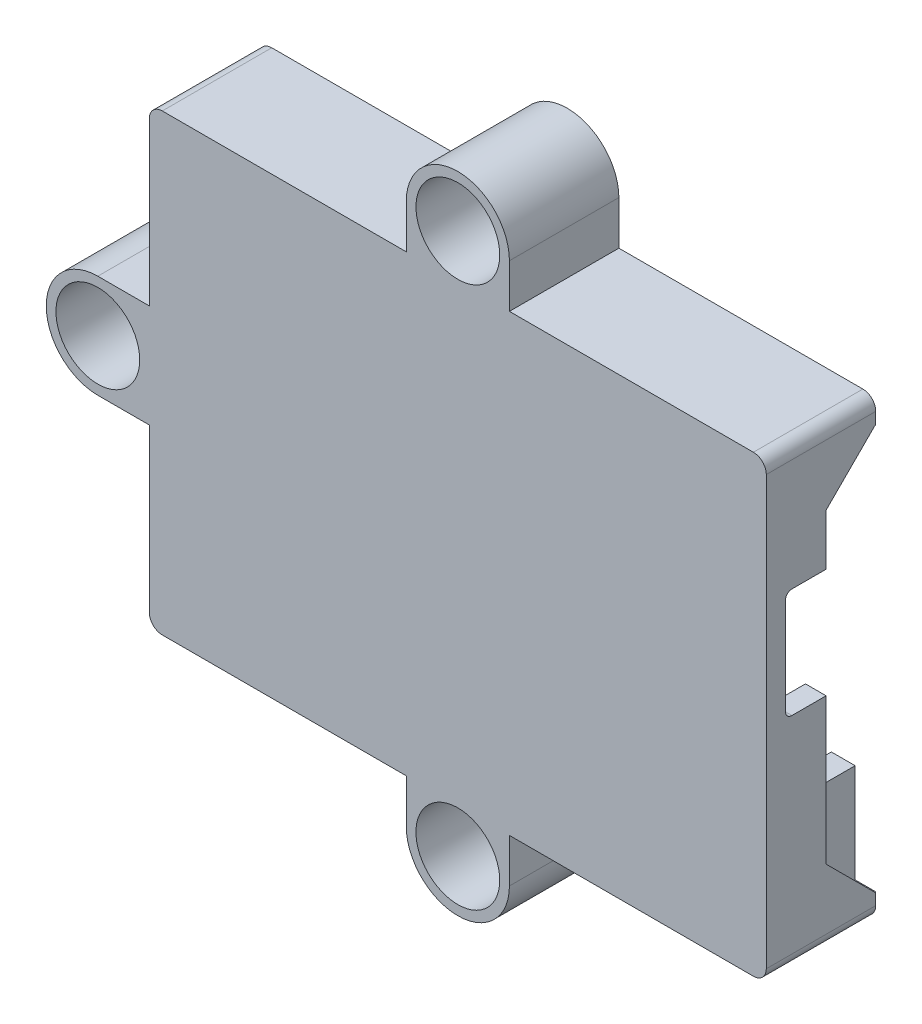
from build123d import *

# Parameters (mm, degrees)
SKETCH1_W           = 47.85
SKETCH1_H           = 35.2
SKETCH1_W_2         = 44.65
SKETCH1_H_2         = 32
BOSS_EXTRUDE1_DEPTH = 6.99
SKETCH2_W           = 47.85
SKETCH2_H           = 35.2
BOSS_EXTRUDE2_DEPTH = 1.5
CUT_EXTRUDE1_REACH  = 53.686
SKETCH4_W           = 3.5
SKETCH4_H           = 8.5
CUT_EXTRUDE2_DEPTH  = 1.6
CUT_EXTRUDE3_REACH  = 45.4
SKETCH6_W           = 10.4
SKETCH6_H           = 6.6
FILLET1_R           = 1
FILLET2_R           = 0.5
SKETCH7_R           = 2
BOSS_EXTRUDE3_DEPTH = 8.49
SKETCH8_R           = 3.25
CUT_EXTRUDE4_DEPTH  = 6.49
BOSS_EXTRUDE4_REACH = 43.428
SKETCH9_W           = 1.6
SKETCH9_H           = 8
SKETCH9_W_2         = 1.845


with BuildPart() as part:
    # Sketch1 → Boss-Extrude1 (new body)
    with BuildSketch(Plane.XY):
        Rectangle(SKETCH1_W, SKETCH1_H)
        Rectangle(SKETCH1_W_2, SKETCH1_H_2, mode=Mode.SUBTRACT)
    extrude(amount=BOSS_EXTRUDE1_DEPTH)

    # Sketch2 → Boss-Extrude2 (add)
    with BuildSketch(Plane.XY.offset(6.99)):
        Rectangle(SKETCH2_W, SKETCH2_H)
    extrude(amount=BOSS_EXTRUDE2_DEPTH)

    # Sketch3 → Cut-Extrude1 (cut, up to next)
    with BuildSketch(Plane(origin=(23.925, 0, 0), x_dir=(0, 0, -1), z_dir=(1, 0, 0)), mode=Mode.PRIVATE) as cut_extrude1_sk1:
        Polygon((-0.070710678, 15.670710678), (0, 15.670710678), (0, -15.670710678), (-0.070710678, -15.670710678), (-3.85, -11.891421356), (-3.85, 11.891421356), align=None)
    cut_extrude1_tool1 = extrude(cut_extrude1_sk1.sketch, amount=-CUT_EXTRUDE1_REACH, mode=Mode.PRIVATE) & part.part
    add(cut_extrude1_tool1.solids().sort_by_distance((23.925, 0, 1.835684))[0], mode=Mode.SUBTRACT)

    # Sketch4 → Cut-Extrude2 (cut)
    with BuildSketch(Plane(origin=(23.925, 0, 0), x_dir=(0, 0, -1), z_dir=(1, 0, 0))):
        with Locations((-5.25, 3.670508357)):
            Rectangle(SKETCH4_W, SKETCH4_H)
    extrude(amount=-CUT_EXTRUDE2_DEPTH, mode=Mode.SUBTRACT)

    # Sketch6 → Cut-Extrude3 (cut, up to next)
    with BuildSketch(Plane.XZ.offset(17.6), mode=Mode.PRIVATE) as cut_extrude3_sk1:
        with Locations((15.28, 3.02)):
            Rectangle(SKETCH6_W, SKETCH6_H)
    cut_extrude3_tool1 = extrude(cut_extrude3_sk1.sketch, amount=-CUT_EXTRUDE3_REACH, mode=Mode.PRIVATE) & part.part
    add(cut_extrude3_tool1.solids().sort_by_distance((15.28, -17.6, 3.02))[0], mode=Mode.SUBTRACT)

    # Fillet1
    fillet1_edges = [part.edges().sort_by_distance(p)[0] for p in [
        (-23.925, 17.6, 4.245),
        (23.925, 17.6, 4.245),
        (23.925, -17.6, 4.245),
        (-23.925, -17.6, 4.245),
    ]]
    fillet(fillet1_edges, radius=FILLET1_R)

    # Fillet2
    # the kernel refuses this fillet: 0.5 mm, written as the material it adds along each edge
    with BuildSketch(Plane(origin=(20.48, -17.6, 6.32), x_dir=(-1, 0, 0), z_dir=(0, 1, 0)), Plane(origin=(10.08, -17.6, 6.32), x_dir=(0, 0, -1), z_dir=(0, 1, 0)), Plane(origin=(23.925, 7.920508357, 7), x_dir=(0, -1, 0), z_dir=(-1, 0, 0)), Plane(origin=(23.925, -0.579491643, 7), x_dir=(0, 0, -1), z_dir=(-1, 0, 0))) as fillet2_piece_1:
        with BuildLine():
            CenterArc((FILLET2_R, -FILLET2_R), FILLET2_R, 90, 90)
            Line((0, -FILLET2_R), (0, 0))
            Line((0, 0), (FILLET2_R, 0))
        make_face()
    extrude(amount=1.6)

    # Sketch7 → Boss-Extrude3 (add)
    # profile 1 of 3: a face of its own
    with BuildSketch(Plane.XY.offset(8.49)):
        with BuildLine():
            Line((4, -17.6), (4, -21))
            ThreePointArc((4, -21), (0, -25), (-4, -21))
            Line((-4, -21), (-4, -17.6))
            Line((-4, -17.6), (4, -17.6))
        make_face()
        with Locations((0, -21)):
            Circle(SKETCH7_R, mode=Mode.SUBTRACT)
    # profile 2 of 3: a face of its own
    with BuildSketch(Plane.XY.offset(8.49)):
        with BuildLine():
            Line((-4, 17.6), (-4, 21))
            ThreePointArc((-4, 21), (0, 25), (4, 21))
            Line((4, 21), (4, 17.6))
            Line((4, 17.6), (-4, 17.6))
        make_face()
        with Locations((0, 21)):
            Circle(SKETCH7_R, mode=Mode.SUBTRACT)
    # profile 3 of 3: a face of its own
    with BuildSketch(Plane.XY.offset(8.49)):
        with BuildLine():
            Line((-23.925, -4), (-27.925, -4))
            ThreePointArc((-27.925, -4), (-31.925, 0), (-27.925, 4))
            Line((-27.925, 4), (-23.925, 4))
            Line((-23.925, 4), (-23.925, -4))
        make_face()
        with Locations((-27.925, 0)):
            Circle(SKETCH7_R, mode=Mode.SUBTRACT)
    extrude(amount=-BOSS_EXTRUDE3_DEPTH)

    # Sketch8 → Cut-Extrude4 (cut)
    with BuildSketch(Plane.XY.offset(8.49)):
        with Locations((0, 21)):
            Circle(SKETCH8_R)
        with Locations((0, -21)):
            Circle(SKETCH8_R)
        with Locations((-27.925, 0)):
            Circle(SKETCH8_R)
    extrude(amount=-CUT_EXTRUDE4_DEPTH, mode=Mode.SUBTRACT)

    # Boss-Extrude4: up to this face of the body (flat: up to its plane)
    boss_extrude4_end = Plane(part.part.faces().sort_by_distance((0, 0, 6.99))[0])
    # Sketch9 → Boss-Extrude4 (add, up to the picked face)
    with BuildSketch(Plane(origin=(0, 0, 0), x_dir=(-1, 0, 0), z_dir=(0, 0, -1)), mode=Mode.PRIVATE) as boss_extrude4_sk1:
        with Locations((-9.28, -12)):
            Rectangle(SKETCH9_W, SKETCH9_H)
    boss_extrude4_tool1 = split(extrude(boss_extrude4_sk1.sketch, amount=-BOSS_EXTRUDE4_REACH, mode=Mode.PRIVATE), bisect_by=boss_extrude4_end, keep=Keep.BOTH, mode=Mode.PRIVATE)
    # Sketch9 → Boss-Extrude4 (add, up to the picked face)
    with BuildSketch(Plane(origin=(0, 0, 0), x_dir=(-1, 0, 0), z_dir=(0, 0, -1)), mode=Mode.PRIVATE) as boss_extrude4_sk2:
        with Locations((-21.4025, -12)):
            Rectangle(SKETCH9_W_2, SKETCH9_H)
    boss_extrude4_tool2 = split(extrude(boss_extrude4_sk2.sketch, amount=-BOSS_EXTRUDE4_REACH, mode=Mode.PRIVATE), bisect_by=boss_extrude4_end, keep=Keep.BOTH, mode=Mode.PRIVATE)
    add(boss_extrude4_tool1.solids().sort_by(Axis((9.28, -12, 0), (0, 0, 1)))[0])
    add(boss_extrude4_tool2.solids().sort_by(Axis((21.4025, -12, 0), (0, 0, 1)))[0])


solid = part.part
